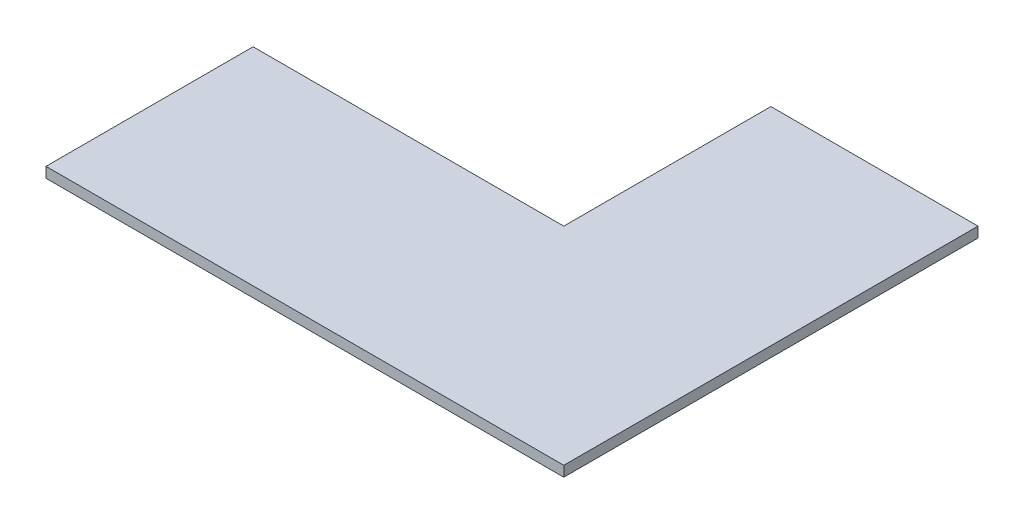
from build123d import *

# Parameters (mm, degrees)
SM_BASE_FLANGE_1_DEPTH = 2


# Sheet-metal steps are written as plain solids
with BuildPart() as part:
    # Sketch 1 → 基体-法兰1 (new body)
    with BuildSketch(Plane(origin=(0, 0, 0), x_dir=(1, 0, 0), z_dir=(0, 1, 0))):
        Polygon((0, 0), (0, 40), (40, 40), (40, -40), (-60, -40), (-60, 0), align=None)
    extrude(amount=-SM_BASE_FLANGE_1_DEPTH)


solid = part.part
